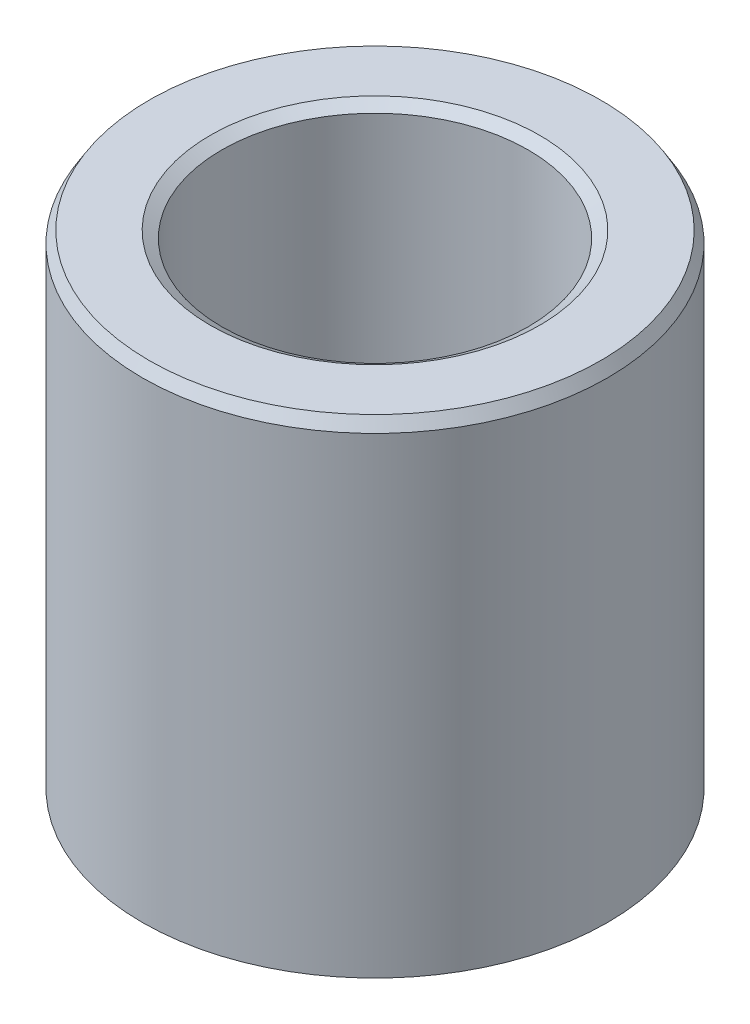
from build123d import *
from OCP.BRepFilletAPI import BRepFilletAPI_MakeChamfer

# Parameters (mm, degrees)
SKETCH1_R           = 50
BOSS_EXTRUDE1_DEPTH = 105.320446027
SKETCH2_R           = 32.92927461
CUT_EXTRUDE1_DEPTH  = 127.855809293
CHAMFER1_SIZE       = 2.456631218
CHAMFER1_SIZE2      = 1.494239277


with BuildPart() as part:
    # Sketch1 → Boss-Extrude1 (new body)
    with BuildSketch(Plane(origin=(0, 0, 0), x_dir=(1, 0, 0), z_dir=(0, 1, 0))):
        Circle(SKETCH1_R)
    extrude(amount=BOSS_EXTRUDE1_DEPTH)

    # Sketch2 → Cut-Extrude1 (cut, through all)
    with BuildSketch(Plane(origin=(0, 0, 0), x_dir=(1, 0, 0), z_dir=(0, 1, 0))):
        Circle(SKETCH2_R)
    extrude(amount=CUT_EXTRUDE1_DEPTH, mode=Mode.SUBTRACT)

    # Chamfer1: one chamfer whose edges measure the first distance from different faces: ONE call of the kernel's chamfer builder (chamfer() names one face for all edges)
    chamfer1_edges_1 = [part.edges().sort_by_distance(p)[0] for p in [
        (-32.92927461, 105.320446027, 0),
    ]]
    chamfer1_side_1 = [part.faces().sort_by_distance(p)[0] for p in [
        (-48.585786438, 105.320446027, 0),
    ]]
    chamfer1_edges_2 = [part.edges().sort_by_distance(p)[0] for p in [
        (-32.92927461, 0, 0),
    ]]
    chamfer1_side_2 = [part.faces().sort_by_distance(p)[0] for p in [
        (-32.92927461, 52.660223013, 0),
    ]]
    chamfer1_edges_3 = [part.edges().sort_by_distance(p)[0] for p in [
        (-50, 0, 0),
    ]]
    chamfer1_side_3 = [part.faces().sort_by_distance(p)[0] for p in [
        (-48.585786438, 0, 0),
    ]]
    chamfer1_edges_4 = [part.edges().sort_by_distance(p)[0] for p in [
        (-50, 105.320446027, 0),
    ]]
    chamfer1_side_4 = [part.faces().sort_by_distance(p)[0] for p in [
        (-50, 52.660223013, 0),
    ]]
    chamfer1 = BRepFilletAPI_MakeChamfer(part.part.solid().wrapped)
    for e in chamfer1_edges_1:
        chamfer1.Add(CHAMFER1_SIZE, CHAMFER1_SIZE2, e.wrapped, chamfer1_side_1[0].wrapped)  # the first distance lies on this face
    for e in chamfer1_edges_2:
        chamfer1.Add(CHAMFER1_SIZE, CHAMFER1_SIZE2, e.wrapped, chamfer1_side_2[0].wrapped)  # the first distance lies on this face
    for e in chamfer1_edges_3:
        chamfer1.Add(CHAMFER1_SIZE, CHAMFER1_SIZE2, e.wrapped, chamfer1_side_3[0].wrapped)  # the first distance lies on this face
    for e in chamfer1_edges_4:
        chamfer1.Add(CHAMFER1_SIZE, CHAMFER1_SIZE2, e.wrapped, chamfer1_side_4[0].wrapped)  # the first distance lies on this face
    add(Compound.cast(chamfer1.Shape()), mode=Mode.REPLACE)


solid = part.part
